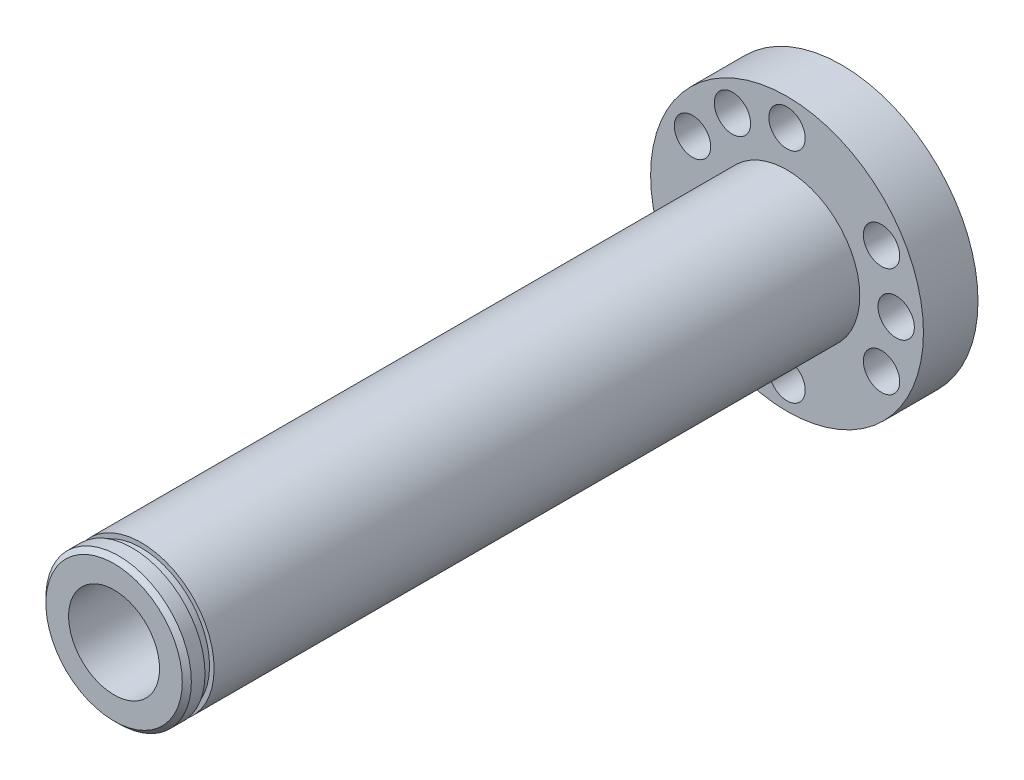
from build123d import *

# Parameters (mm, degrees)
SKETCH_1_R          = 15
SKETCH_1_R_2        = 2
SKETCH_1_R_3        = 5
EXTRUDE_1_DEPTH     = 10
SKETCH_2_R          = 8
SKETCH_2_R_2        = 5
EXTRUDE_2_DEPTH     = 70
SKETCH_3_R          = 2.5
CUT_EXTRUDE_1_DEPTH = 10
CUT_EXTRUDE_START   = -4
SKETCH_4_R          = 18.074037985
SKETCH_4_R_2        = 8
CUT_EXTRUDE_2_DEPTH = 4
CHAMFER_1_SIZE      = 0.5
SKETCH_5_W          = 0.5
SKETCH_5_H          = 1


with BuildPart() as part:
    # 草图1 → 凸台-拉伸1 (new body)
    with BuildSketch(Plane.XY):
        Circle(SKETCH_1_R)
        with Locations((0, 12)):
            Circle(SKETCH_1_R_2, mode=Mode.SUBTRACT)
        with Locations((10.392304845, 6)):
            Circle(SKETCH_1_R_2, mode=Mode.SUBTRACT)
        with Locations((10.392304845, -6)):
            Circle(SKETCH_1_R_2, mode=Mode.SUBTRACT)
        with Locations((0, -12)):
            Circle(SKETCH_1_R_2, mode=Mode.SUBTRACT)
        with Locations((-10.392304845, -6)):
            Circle(SKETCH_1_R_2, mode=Mode.SUBTRACT)
        with Locations((-10.392304845, 6)):
            Circle(SKETCH_1_R_2, mode=Mode.SUBTRACT)
        with Locations((-6, 10.392304845)):
            Circle(SKETCH_1_R_2, mode=Mode.SUBTRACT)
        with Locations((12, 0)):
            Circle(SKETCH_1_R_2, mode=Mode.SUBTRACT)
        with Locations((-6, -10.392304845)):
            Circle(SKETCH_1_R_2, mode=Mode.SUBTRACT)
        Circle(SKETCH_1_R_3, mode=Mode.SUBTRACT)
    extrude(amount=EXTRUDE_1_DEPTH)

    # 草图2 → 凸台-拉伸2 (add)
    with BuildSketch(Plane.XY.offset(10)):
        Circle(SKETCH_2_R)
        Circle(SKETCH_2_R_2, mode=Mode.SUBTRACT)
    extrude(amount=EXTRUDE_2_DEPTH)

    # 草图3 → 切除-拉伸1 (cut)
    with BuildSketch(Plane(origin=(0, 0, 0), x_dir=(1, 0, 0), z_dir=(0, 1, 0))):
        with Locations((0.676832819, -59)):
            Circle(SKETCH_3_R)
    extrude(amount=-CUT_EXTRUDE_1_DEPTH, mode=Mode.SUBTRACT)

    # 草图4 → 切除-拉伸2 (cut)
    with BuildSketch(Plane.XY.offset(10).offset(CUT_EXTRUDE_START)):
        Circle(SKETCH_4_R)
        Circle(SKETCH_4_R_2, mode=Mode.SUBTRACT)
    extrude(amount=CUT_EXTRUDE_2_DEPTH, mode=Mode.SUBTRACT)

    # Chamfer 1
    chamfer_1_edges = [part.edges().sort_by_distance(p)[0] for p in [
        (-8, 0, 80),
    ]]
    chamfer(chamfer_1_edges, length=CHAMFER_1_SIZE)

    # 切除-扫描2: sweep along a path in 草图6
    with BuildLine(Plane.XY.offset(80)) as sweep_2_path:
        CenterArc((0, 0), 7.5, 0, 360)
    # 草图5 → 切除-扫描2 (sweep, cut)
    with BuildSketch(Plane(origin=(0, 0, 0), x_dir=(1, 0, 0), z_dir=(0, 1, 0))):
        with Locations((7.75, -77.5)):
            Rectangle(SKETCH_5_W, SKETCH_5_H)
    sweep(path=sweep_2_path.line, mode=Mode.SUBTRACT)


solid = part.part
